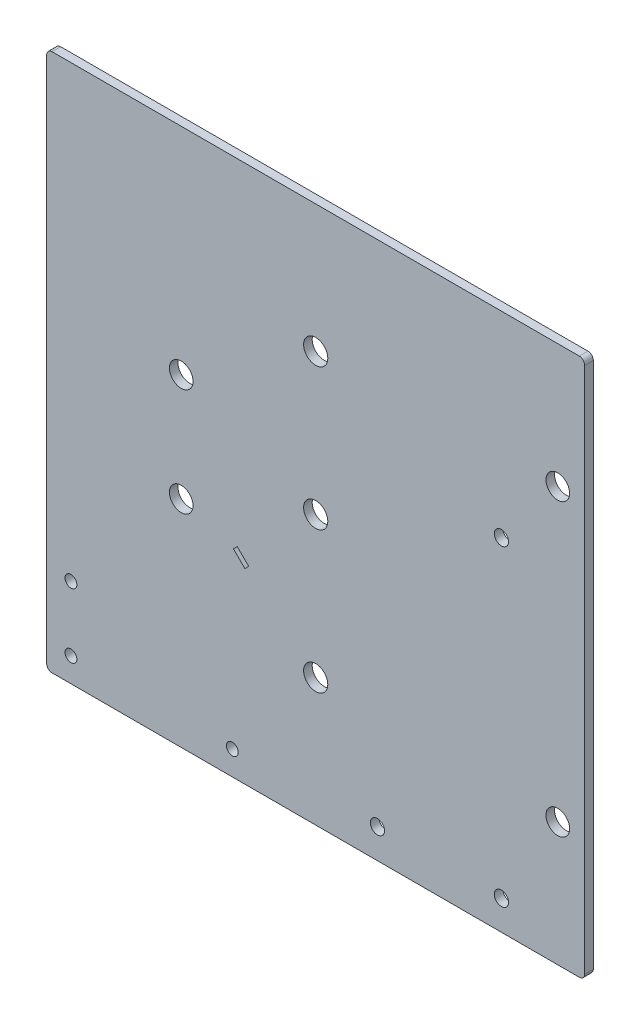
from build123d import *

# Parameters (mm, degrees)
SKETCH1_W           = 100
SKETCH1_H           = 100
BOSS_EXTRUDE1_DEPTH = 1.6
SKETCH3_R           = 2.2479
SKETCH3_R_2         = 1.325
SKETCH3_R_3         = 2.2
SKETCH3_R_4         = 1.1
CUT_EXTRUDE2_DEPTH  = 71.728777736
FILLET1_R           = 1
CUT_EXTRUDE4_DEPTH  = 71.728777736


with BuildPart() as part:
    # Sketch1 → Boss-Extrude1 (new body)
    with BuildSketch(Plane.XY):
        Rectangle(SKETCH1_W, SKETCH1_H)
    extrude(amount=BOSS_EXTRUDE1_DEPTH)

    # Sketch3 → Cut-Extrude2 (cut, through all)
    with BuildSketch(Plane(origin=(0, 0, 1.6), x_dir=(-1, 0, 0), z_dir=(0, 0, -1))):
        with Locations((0, 26.25)):
            Circle(SKETCH3_R)
        Circle(SKETCH3_R)
        with Locations((-34.525, -44.525)):
            Circle(SKETCH3_R_2)
        with Locations((0, -26.25)):
            Circle(SKETCH3_R)
        with Locations((-45, -27)):
            Circle(SKETCH3_R_3)
        with Locations((-45, 27)):
            Circle(SKETCH3_R_3)
        with Locations((-34.525, 13.525)):
            Circle(SKETCH3_R_2)
        with Locations((15.5, -45.5)):
            Circle(SKETCH3_R_4)
        with Locations((45.5, -45.5)):
            Circle(SKETCH3_R_4)
        with Locations((45.5, -33.5)):
            Circle(SKETCH3_R_4)
        with Locations((-11.475, -44.525)):
            Circle(SKETCH3_R_2)
        with Locations((25, -10)):
            Circle(SKETCH3_R_3)
        with Locations((25, 10)):
            Circle(SKETCH3_R_3)
    extrude(amount=CUT_EXTRUDE2_DEPTH, mode=Mode.SUBTRACT)

    # Fillet1
    fillet1_edges = [part.edges().sort_by_distance(p)[0] for p in [
        (-50, -50, 0.8),
        (-50, 50, 0.8),
        (50, -50, 0.8),
        (50, 50, 0.8),
    ]]
    fillet(fillet1_edges, radius=FILLET1_R)

    # Sketch5 → Cut-Extrude4 (cut, through all)
    with BuildSketch(Plane(origin=(0, 0, 0), x_dir=(-1, 0, 0), z_dir=(0, 0, -1))):
        Polygon((12.457840159, -14.579231268), (14.579529723, -12.458280208), (15.286513409, -13.165510063), (13.164823846, -15.286461122), align=None)
    extrude(amount=-CUT_EXTRUDE4_DEPTH, mode=Mode.SUBTRACT)


solid = part.part
